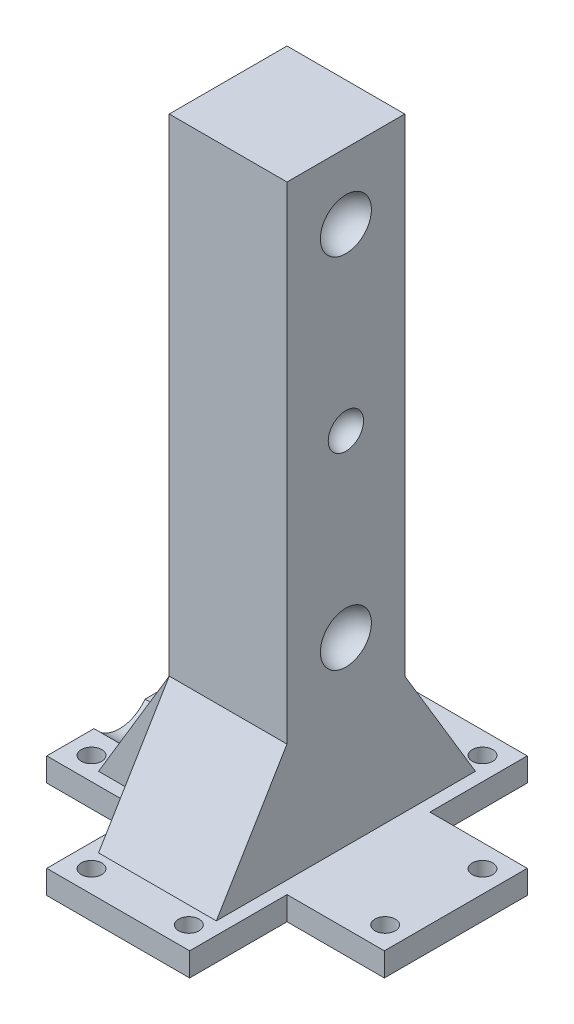
from build123d import *

# Parameters (mm, degrees)
SKETCH_1_W                  = 86
SKETCH_1_H                  = 86
EXTRUDE_1_DEPTH             = 6
SKETCH_2_W                  = 30
SKETCH_2_H                  = 30
EXTRUDE_2_DEPTH             = 160
EXTRUDE_3_REACH             = 173.167
EXTRUDE_3_DIRECTION_2_REACH = 173.167
SKETCH_8_R                  = 2.6
CUT_EXTRUDE_2_DEPTH         = 6
CUT_EXTRUDE_3_DEPTH         = 6
PATTERN_LINEAR_1_COUNT      = 2
PATTERN_LINEAR_1_PITCH      = 91.2
MIRROR_7_COPY_1_DEPTH       = 6
MIRROR_8_COPY_1_SKETCH_R    = 2.6
MIRROR_8_COPY_1_DEPTH       = 6
PATTERN_CIRCULAR_1_COUNT    = 2
PATTERN_CIRCULAR_1_ANGLE    = 90
MIRROR_9_COPY_1_SKETCH_R    = 2.6
MIRROR_9_COPY_1_DEPTH       = 6
MIRROR_9_COPY_2_SKETCH_R    = 2.6
MIRROR_9_COPY_2_DEPTH       = 6
MIRROR_10_COPY_1_SKETCH_R   = 2.6
MIRROR_10_COPY_1_DEPTH      = 6
MIRROR_10_COPY_2_SKETCH_R   = 2.6
MIRROR_10_COPY_2_DEPTH      = 6
MIRROR_10_COPY_3_SKETCH_R   = 2.6
MIRROR_10_COPY_3_DEPTH      = 6
MIRROR_10_COPY_4_SKETCH_R   = 2.6
MIRROR_10_COPY_4_DEPTH      = 6
MIRROR_10_COPY_5_SKETCH_R   = 2.6
MIRROR_10_COPY_5_DEPTH      = 6
EXTRUDE_4_DEPTH             = 15
CUT_EXTRUDE_START           = -172.166585524
SKETCH_17_W                 = 15.666596152
SKETCH_17_H                 = 20.507289597
CUT_EXTRUDE_4_DEPTH         = 177.166585524
SKETCH_18_R                 = 7.890659629
SKETCH_18_R_2               = 8.087611604
CUT_EXTRUDE_5_DEPTH         = 177.166585524
PATTERN_START               = -8.175929672
PATTERN_LINEAR_2_OUTLINE_W  = 20
PATTERN_LINEAR_2_OUTLINE_H  = 20.507289597
PATTERN_LINEAR_2_DEPTH      = 15.666596152
PATTERN_LINEAR_3_COUNT      = 3
PATTERN_LINEAR_3_PITCH      = 60


# Read off the part's stored shape, not the designer's step: 阵列(线性)2
with BuildPart() as part:
    # 草图1 → 凸台-拉伸1 (new body)
    with BuildSketch(Plane(origin=(0, 0, 0), x_dir=(1, 0, 0), z_dir=(0, 1, 0))):
        Rectangle(SKETCH_1_W, SKETCH_1_H)
    extrude(amount=EXTRUDE_1_DEPTH)

    # 草图2 → 凸台-拉伸2 (add)
    with BuildSketch(Plane(origin=(0, 0, 0), x_dir=(1, 0, 0), z_dir=(0, 1, 0))):
        Rectangle(SKETCH_2_W, SKETCH_2_H)
    extrude(amount=EXTRUDE_2_DEPTH)

    # 凸台-拉伸3: up to this face of the body (flat: up to its plane)
    extrude_3_end = Plane(part.part.faces().sort_by_distance((0, 83, 15))[0])
    # 草图7 → 凸台-拉伸3 (add, up to the picked face)
    with BuildSketch(Plane.XY, mode=Mode.PRIVATE) as extrude_3_sk1:
        Polygon((-15, 36), (-33, 6), (-15, 6), align=None)
    extrude_3_tool1 = split(extrude(extrude_3_sk1.sketch, amount=EXTRUDE_3_REACH, mode=Mode.PRIVATE), bisect_by=extrude_3_end, keep=Keep.BOTH, mode=Mode.PRIVATE)
    add(extrude_3_tool1.solids().sort_by(Axis((-21, 16, 0), (0, 0, 1)))[0])

    # 凸台-拉伸3 direction 2: up to this face of the body (flat: up to its plane)
    extrude_3_direction_2_end = Plane(part.part.faces().sort_by_distance((0, 83, -15))[0])
    # 草图7 → 凸台-拉伸3 direction 2 (add, up to the picked face)
    with BuildSketch(Plane.XY, mode=Mode.PRIVATE) as extrude_3_direction_2_sk1:
        Polygon((-15, 36), (-33, 6), (-15, 6), align=None)
    extrude_3_direction_2_tool1 = split(extrude(extrude_3_direction_2_sk1.sketch, amount=-EXTRUDE_3_DIRECTION_2_REACH, mode=Mode.PRIVATE), bisect_by=extrude_3_direction_2_end, keep=Keep.BOTH, mode=Mode.PRIVATE)
    add(extrude_3_direction_2_tool1.solids().sort_by(Axis((-21, 16, 0), (0, 0, -1)))[0])

    # 草图8 → 切除-拉伸2 (cut)
    with BuildSketch(Plane(origin=(0, 0, 0), x_dir=(1, 0, 0), z_dir=(0, 1, 0))):
        with Locations(Location((-12.4, 37.4, 0), (0, 0, 270))):
            Circle(SKETCH_8_R)
    cut_extrude_2 = extrude(amount=CUT_EXTRUDE_2_DEPTH, mode=Mode.SUBTRACT)

    # 镜向2: 切除-拉伸2 across plane
    add(cut_extrude_2.mirror(Plane.XY), mode=Mode.SUBTRACT)

    # 草图11 → 切除-拉伸3 (cut)
    with BuildSketch(Plane(origin=(0, 0, 0), x_dir=(1, 0, 0), z_dir=(0, 1, 0))):
        Polygon((264.106039705, -18.2), (43, -18.2), (18.2, -18.2), (18.2, -43), (18.2, -264.106039705), (330.891160074, -576.797199779), (576.797199779, -330.891160074), align=None)
    cut_extrude_3 = extrude(amount=CUT_EXTRUDE_3_DEPTH, mode=Mode.SUBTRACT)

    # 草图12 → 切除-旋转2 (revolve, cut)
    with BuildSketch(Plane.XY):
        with BuildLine():
            Line((15, 58.5), (15, 45.5))
            ThreePointArc((15, 45.5), (8.5, 52), (15, 58.5))
        make_face()
    cut_revolve_2 = revolve(axis=Axis((15, 58.5, 0), (0, -1, 0)), mode=Mode.SUBTRACT)

    # 阵列(线性)1: 切除-旋转2 ×2
    with Locations(*[(0, i * PATTERN_LINEAR_1_PITCH, 0) for i in range(1, PATTERN_LINEAR_1_COUNT)]):
        add(cut_revolve_2, mode=Mode.SUBTRACT)

    # 镜向6: 切除-拉伸3 across plane
    add(cut_extrude_3.mirror(Plane.XY), mode=Mode.SUBTRACT)

    # 镜向7: 切除-拉伸3 across plane
    add(cut_extrude_3.mirror(Plane(origin=(0, 0, 0), x_dir=(0, 0, 1), z_dir=(1, 0, 0))), mode=Mode.SUBTRACT)

    # 镜向7 copy 1 sketch → 镜向7 copy 1 (cut)
    with BuildSketch(Plane(origin=(0, 0, 0), x_dir=(-1, 0, 0), z_dir=(0, 1, 0))):
        Polygon((264.106039705, -18.2), (43, -18.2), (18.2, -18.2), (18.2, -43), (18.2, -264.106039705), (330.891160074, -576.797199779), (576.797199779, -330.891160074), align=None)
    extrude(amount=MIRROR_7_COPY_1_DEPTH, mode=Mode.SUBTRACT)

    # 镜向8: 切除-拉伸2 across plane
    add(cut_extrude_2.mirror(Plane(origin=(0, 0, 0), x_dir=(0, 0, 1), z_dir=(1, 0, 0))), mode=Mode.SUBTRACT)

    # 镜向8 copy 1 sketch → 镜向8 copy 1 (cut)
    with BuildSketch(Plane(origin=(0, 0, 0), x_dir=(-1, 0, 0), z_dir=(0, 1, 0))):
        with Locations(Location((-12.4, 37.4, 0), (0, 0, 270))):
            Circle(MIRROR_8_COPY_1_SKETCH_R)
    extrude(amount=MIRROR_8_COPY_1_DEPTH, mode=Mode.SUBTRACT)

    # 阵列(圆周)1: 切除-拉伸2 ×2 about axis
    pattern_circular_1_axis = Axis((0, 0, 0), (0, 1, 0))
    for i in range(1, PATTERN_CIRCULAR_1_COUNT):
        add(cut_extrude_2.rotate(pattern_circular_1_axis, i * PATTERN_CIRCULAR_1_ANGLE / (PATTERN_CIRCULAR_1_COUNT - 1)), mode=Mode.SUBTRACT)

    # 镜向9 copy 1 sketch → 镜向9 copy 1 (cut)
    with BuildSketch(Plane.ZX):
        with Locations((-12.4, -37.4)):
            Circle(MIRROR_9_COPY_1_SKETCH_R)
    extrude(amount=MIRROR_9_COPY_1_DEPTH, mode=Mode.SUBTRACT)

    # 镜向9 copy 2 sketch → 镜向9 copy 2 (cut)
    with BuildSketch(Plane(origin=(0, 0, 0), x_dir=(1, 0, 0), z_dir=(0, 1, 0))):
        with Locations((-12.4, -37.4)):
            Circle(MIRROR_9_COPY_2_SKETCH_R)
    extrude(amount=MIRROR_9_COPY_2_DEPTH, mode=Mode.SUBTRACT)

    # 镜向10 copy 1 sketch → 镜向10 copy 1 (cut)
    with BuildSketch(Plane(origin=(0, 0, 0), x_dir=(0, 0, -1), z_dir=(0, 1, 0))):
        with Locations((-12.4, -37.4)):
            Circle(MIRROR_10_COPY_1_SKETCH_R)
    extrude(amount=MIRROR_10_COPY_1_DEPTH, mode=Mode.SUBTRACT)

    # 镜向10 copy 2 sketch → 镜向10 copy 2 (cut)
    with BuildSketch(Plane(origin=(0, 0, 0), x_dir=(-1, 0, 0), z_dir=(0, 1, 0))):
        with Locations((-12.4, -37.4)):
            Circle(MIRROR_10_COPY_2_SKETCH_R)
    extrude(amount=MIRROR_10_COPY_2_DEPTH, mode=Mode.SUBTRACT)

    # 镜向10 copy 3 sketch → 镜向10 copy 3 (cut)
    with BuildSketch(Plane.ZX):
        with Locations(Location((-12.4, 37.4, 0), (0, 0, 270))):
            Circle(MIRROR_10_COPY_3_SKETCH_R)
    extrude(amount=MIRROR_10_COPY_3_DEPTH, mode=Mode.SUBTRACT)

    # 镜向10 copy 4 sketch → 镜向10 copy 4 (cut)
    with BuildSketch(Plane(origin=(0, 0, 0), x_dir=(-1, 0, 0), z_dir=(0, 1, 0))):
        with Locations(Location((-12.4, 37.4, 0), (0, 0, 270))):
            Circle(MIRROR_10_COPY_4_SKETCH_R)
    extrude(amount=MIRROR_10_COPY_4_DEPTH, mode=Mode.SUBTRACT)

    # 镜向10 copy 5 sketch → 镜向10 copy 5 (cut)
    with BuildSketch(Plane(origin=(0, 0, 0), x_dir=(-1, 0, 0), z_dir=(0, 1, 0))):
        with Locations((-12.4, -37.4)):
            Circle(MIRROR_10_COPY_5_SKETCH_R)
    extrude(amount=MIRROR_10_COPY_5_DEPTH, mode=Mode.SUBTRACT)

    # 草图15 → 凸台-拉伸4 (add, symmetric)
    with BuildSketch(Plane(origin=(0, 0, 0), x_dir=(0, 0, -1), z_dir=(1, 0, 0))):
        Polygon((-15, 36), (-15, 6), (-33, 6), align=None)
    extrude_4 = extrude(amount=EXTRUDE_4_DEPTH, both=True)

    # 镜向11: 凸台-拉伸4 across plane
    add(extrude_4.mirror(Plane.XY))

    # 草图16 → 切除-旋转3 (revolve, cut)
    with BuildSketch(Plane.XY):
        with BuildLine():
            Line((15, 102.1), (15, 93.1))
            ThreePointArc((15, 93.1), (19.5, 97.6), (15, 102.1))
        make_face()
    revolve(axis=Axis((15, 102.1, 0), (0, -1, 0)), mode=Mode.SUBTRACT)

    # 草图17 → 切除-拉伸4 (cut)
    with BuildSketch(Plane(origin=(0, 0, 0), x_dir=(0, 0, -1), z_dir=(1, 0, 0)).offset(CUT_EXTRUDE_START)):
        with Locations((0.342631596, 141.05128602)):
            Rectangle(SKETCH_17_W, SKETCH_17_H)
    extrude(amount=CUT_EXTRUDE_4_DEPTH, mode=Mode.SUBTRACT)

    # 草图18 → 切除-拉伸5 (cut)
    with BuildSketch(Plane(origin=(0, 0, 0), x_dir=(0, 0, -1), z_dir=(1, 0, 0)).offset(CUT_EXTRUDE_START)):
        with Locations((0.342631596, 151.304930818)):
            Circle(SKETCH_18_R)
        with Locations((0.342631596, 130.797641221)):
            Circle(SKETCH_18_R_2)
    cut_extrude_5 = extrude(amount=CUT_EXTRUDE_5_DEPTH, mode=Mode.SUBTRACT)

    # 阵列(线性)2 outline → 阵列(线性)2 (cut)
    with BuildSketch(Plane.XY.offset(PATTERN_START)):
        with Locations((-5, 81.051286019)):
            Rectangle(PATTERN_LINEAR_2_OUTLINE_W, PATTERN_LINEAR_2_OUTLINE_H)
        Polygon((5, 10.797641221), (5, 31.304930818), (-17.817041509, 31.304930818), (-30.121415267, 10.797641221), align=None)
    extrude(amount=PATTERN_LINEAR_2_DEPTH, mode=Mode.SUBTRACT)

    # 阵列(线性)3: 切除-拉伸5 ×3
    with Locations(*[(0, -i * PATTERN_LINEAR_3_PITCH, 0) for i in range(1, PATTERN_LINEAR_3_COUNT)]):
        add(cut_extrude_5, mode=Mode.SUBTRACT)


solid = part.part
